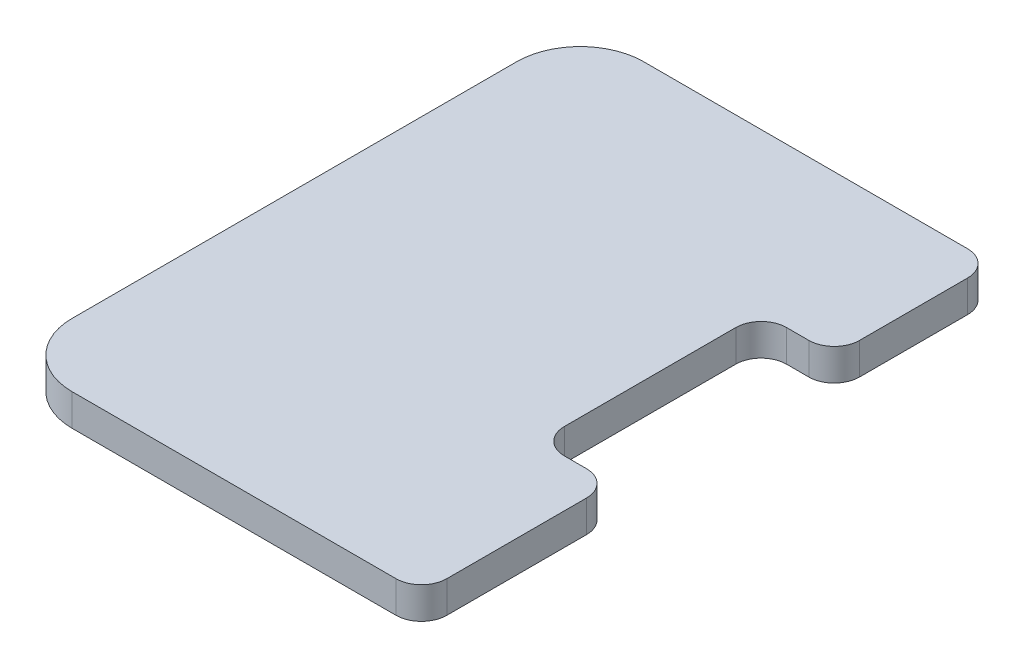
from build123d import *

# Parameters (mm, degrees)
SKETCH1_W           = 41.275
SKETCH1_H           = 57.15
BOSS_EXTRUDE1_DEPTH = 3.175
SKETCH2_W           = 7.3025
SKETCH2_H           = 22.225
CUT_EXTRUDE2_DEPTH  = 36.390926185
FILLET1_R           = 2.54
FILLET2_R           = 6.35


with BuildPart() as part:
    # Sketch1 → Boss-Extrude1 (new body)
    with BuildSketch(Plane(origin=(0, 0, 0), x_dir=(1, 0, 0), z_dir=(0, 1, 0))):
        Rectangle(SKETCH1_W, SKETCH1_H)
    extrude(amount=BOSS_EXTRUDE1_DEPTH)

    # Sketch2 → Cut-Extrude2 (cut, through all)
    with BuildSketch(Plane(origin=(0, 3.175, 0), x_dir=(1, 0, 0), z_dir=(0, 1, 0))):
        with Locations((16.98625, 1.5875)):
            Rectangle(SKETCH2_W, SKETCH2_H)
    extrude(amount=-CUT_EXTRUDE2_DEPTH, mode=Mode.SUBTRACT)

    # Fillet1
    fillet1_edges = [part.edges().sort_by_distance(p)[0] for p in [
        (20.6375, 1.5875, 28.575),
        (20.6375, 1.5875, -28.575),
        (20.6375, 1.5875, 9.525),
        (13.335, 1.5875, 9.525),
        (20.6375, 1.5875, -12.7),
        (13.335, 1.5875, -12.7),
    ]]
    fillet(fillet1_edges, radius=FILLET1_R)

    # Fillet2
    fillet2_edges = [part.edges().sort_by_distance(p)[0] for p in [
        (-20.6375, 1.5875, 28.575),
        (-20.6375, 1.5875, -28.575),
    ]]
    fillet(fillet2_edges, radius=FILLET2_R)


solid = part.part
